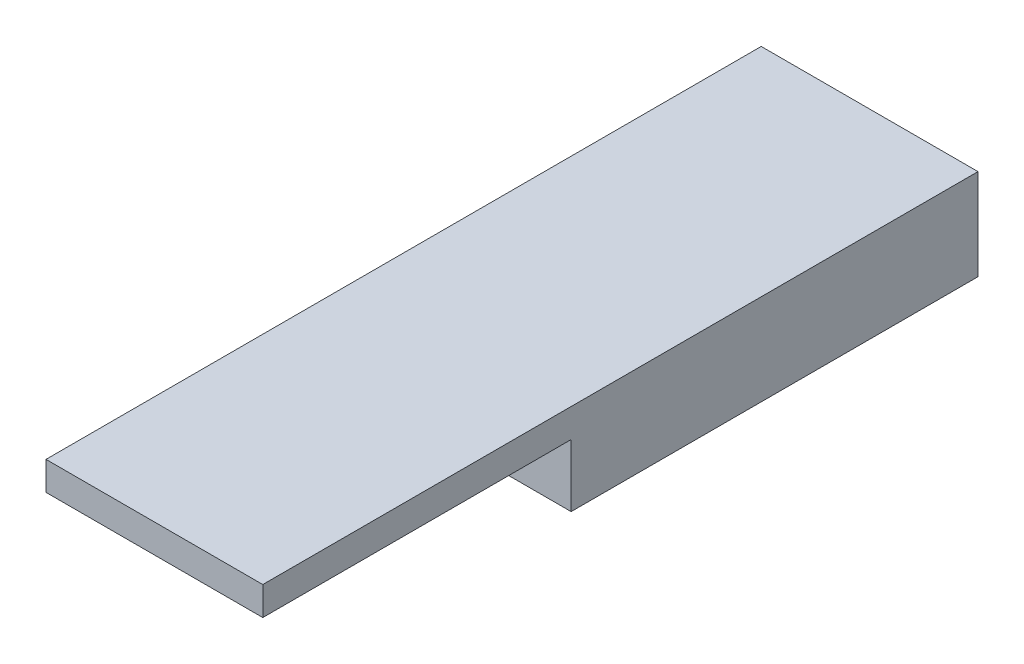
from build123d import *

# Parameters (mm, degrees)
SKETCH1_W           = 12.5
SKETCH1_H           = 41.24
BOSS_EXTRUDE1_DEPTH = 5.25
SKETCH2_W           = 12.5
SKETCH2_H           = 17.78
CUT_EXTRUDE1_DEPTH  = 3.6


with BuildPart() as part:
    # Sketch1 → Boss-Extrude1 (new body)
    with BuildSketch(Plane(origin=(0, 0, 0), x_dir=(1, 0, 0), z_dir=(0, 1, 0))):
        Rectangle(SKETCH1_W, SKETCH1_H)
    extrude(amount=BOSS_EXTRUDE1_DEPTH)

    # Sketch2 → Cut-Extrude1 (cut)
    with BuildSketch(Plane(origin=(0, 0, 0), x_dir=(1, 0, 0), z_dir=(0, 1, 0))):
        with Locations((0, -11.73)):
            Rectangle(SKETCH2_W, SKETCH2_H)
    extrude(amount=CUT_EXTRUDE1_DEPTH, mode=Mode.SUBTRACT)


solid = part.part
